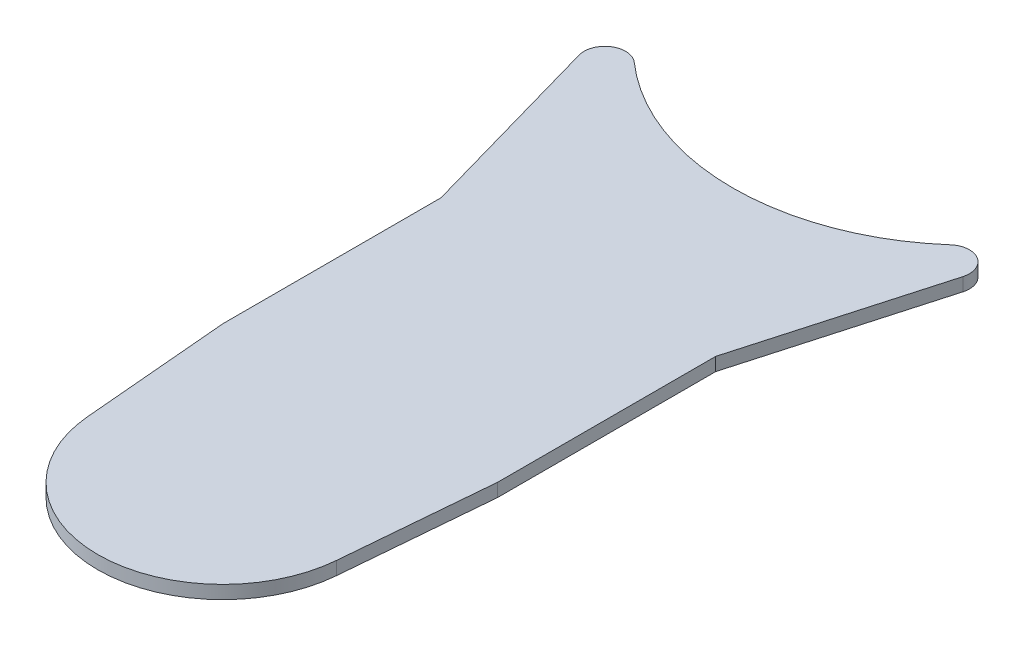
from build123d import *

# Parameters (mm, degrees)
BASE_FLANGE1_DEPTH = 3.175


# Sheet-metal steps are written as plain solids
with BuildPart() as part:
    # Sketch1 → Base-Flange1 (new body)
    with BuildSketch(Plane(origin=(0, 0, 0), x_dir=(1, 0, 0), z_dir=(0, 1, 0))):
        with BuildLine():
            Line((-29.887299957, -182.597941739), (-32.985733317, -146.952874795))
            Line((-32.985733317, -146.952874795), (-32.985733317, -94.571650999))
            Line((-32.985733317, -94.571650999), (-46.087855458, -48.292438117))
            ThreePointArc((-46.087855458, -48.292438117), (-43.944076056, -42.701188324), (-37.974785272, -43.175985032))
            ThreePointArc((-37.974785272, -43.175985032), (0, -57.5), (37.974785272, -43.175985032))
            ThreePointArc((37.974785272, -43.175985032), (43.944076056, -42.701188324), (46.087855458, -48.292438117))
            Line((46.087855458, -48.292438117), (32.985733317, -94.571650999))
            Line((32.985733317, -94.571650999), (32.985733317, -146.952874795))
            Line((32.985733317, -146.952874795), (29.887299957, -182.597941739))
            ThreePointArc((29.887299957, -182.597941739), (0, -210), (-29.887299957, -182.597941739))
        make_face()
    extrude(amount=-BASE_FLANGE1_DEPTH)


solid = part.part
